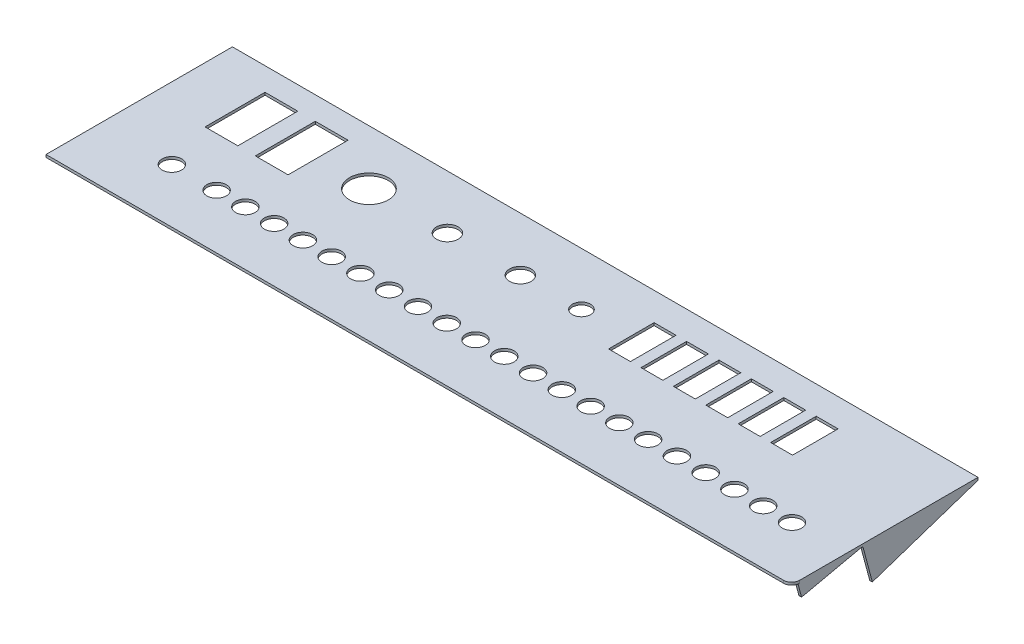
from build123d import *

# Parameters (mm, degrees)
SKETCH4_R           = 11.95
SKETCH4_R_2         = 6.65
SKETCH4_R_3         = 5.6
SKETCH4_R_4         = 6
SKETCH4_W           = 20.218579234
SKETCH4_H           = 37
SKETCH4_W_2         = 13.5
SKETCH4_H_2         = 28.1
BOSS_EXTRUDE1_DEPTH = 1.6
BOSS_EXTRUDE2_DEPTH = 1.6


with BuildPart() as part:
    # Sketch4 → Boss-Extrude1 (new body)
    with BuildSketch(Plane(origin=(0, 0, 0), x_dir=(1, 0, 0), z_dir=(0, 1, 0))):
        with BuildLine():
            Line((-60.547420146, 63.390203379), (394.452579854, 63.390203379))
            Line((394.452579854, 63.390203379), (396.952579854, 63.390203379))
            Line((396.952579854, 63.390203379), (396.952579854, -46.609796621))
            ThreePointArc((396.952579854, -46.609796621), (395.48811376, -50.145330527), (391.952579854, -51.609796621))
            Line((391.952579854, -51.609796621), (-60.547420146, -51.609796621))
            Line((-60.547420146, -51.609796621), (-63.047420146, -51.609796621))
            Line((-63.047420146, -51.609796621), (-63.047420146, 63.390203379))
            Line((-63.047420146, 63.390203379), (-60.547420146, 63.390203379))
        make_face()
        with Locations((54.9, 29.690203379)):
            Circle(SKETCH4_R, mode=Mode.SUBTRACT)
        with Locations((102.75, 30.240203379)):
            Circle(SKETCH4_R_2, mode=Mode.SUBTRACT)
        with Locations((147.75, 30.240203379)):
            Circle(SKETCH4_R_2, mode=Mode.SUBTRACT)
        with Locations((184.9, 30.790203379)):
            Circle(SKETCH4_R_3, mode=Mode.SUBTRACT)
        with Locations((-18.9, -18.109796621)):
            Circle(SKETCH4_R_4, mode=Mode.SUBTRACT)
        with Locations((8.7, -18.109796621)):
            Circle(SKETCH4_R_4, mode=Mode.SUBTRACT)
        with Locations((26.45, -18.109796621)):
            Circle(SKETCH4_R_4, mode=Mode.SUBTRACT)
        with Locations((44.2, -18.109796621)):
            Circle(SKETCH4_R_4, mode=Mode.SUBTRACT)
        with Locations((61.95, -18.109796621)):
            Circle(SKETCH4_R_4, mode=Mode.SUBTRACT)
        with Locations((79.7, -18.109796621)):
            Circle(SKETCH4_R_4, mode=Mode.SUBTRACT)
        with Locations((97.45, -18.109796621)):
            Circle(SKETCH4_R_4, mode=Mode.SUBTRACT)
        with Locations((115.2, -18.109796621)):
            Circle(SKETCH4_R_4, mode=Mode.SUBTRACT)
        with Locations((132.95, -18.109796621)):
            Circle(SKETCH4_R_4, mode=Mode.SUBTRACT)
        with Locations((150.7, -18.109796621)):
            Circle(SKETCH4_R_4, mode=Mode.SUBTRACT)
        with Locations((168.45, -18.109796621)):
            Circle(SKETCH4_R_4, mode=Mode.SUBTRACT)
        with Locations((186.2, -18.109796621)):
            Circle(SKETCH4_R_4, mode=Mode.SUBTRACT)
        with Locations((203.95, -18.109796621)):
            Circle(SKETCH4_R_4, mode=Mode.SUBTRACT)
        with Locations((221.7, -18.109796621)):
            Circle(SKETCH4_R_4, mode=Mode.SUBTRACT)
        with Locations((239.45, -18.109796621)):
            Circle(SKETCH4_R_4, mode=Mode.SUBTRACT)
        with Locations((257.2, -18.109796621)):
            Circle(SKETCH4_R_4, mode=Mode.SUBTRACT)
        with Locations((274.95, -18.109796621)):
            Circle(SKETCH4_R_4, mode=Mode.SUBTRACT)
        with Locations((292.7, -18.109796621)):
            Circle(SKETCH4_R_4, mode=Mode.SUBTRACT)
        with Locations((310.45, -18.109796621)):
            Circle(SKETCH4_R_4, mode=Mode.SUBTRACT)
        with Locations((328.2, -18.109796621)):
            Circle(SKETCH4_R_4, mode=Mode.SUBTRACT)
        with Locations((345.95, -18.109796621)):
            Circle(SKETCH4_R_4, mode=Mode.SUBTRACT)
        with Locations((363.7, -18.109796621)):
            Circle(SKETCH4_R_4, mode=Mode.SUBTRACT)
        with Locations((-18.6, 30.690203379)):
            Rectangle(SKETCH4_W, SKETCH4_H, mode=Mode.SUBTRACT)
        with Locations((12.4, 30.690203379)):
            Rectangle(SKETCH4_W, SKETCH4_H, mode=Mode.SUBTRACT)
        with Locations((241.15, 32.073143277)):
            Rectangle(SKETCH4_W_2, SKETCH4_H_2, mode=Mode.SUBTRACT)
        with Locations((221.15, 32.073143277)):
            Rectangle(SKETCH4_W_2, SKETCH4_H_2, mode=Mode.SUBTRACT)
        with Locations((261.15, 32.073143277)):
            Rectangle(SKETCH4_W_2, SKETCH4_H_2, mode=Mode.SUBTRACT)
        with Locations((281.15, 32.073143277)):
            Rectangle(SKETCH4_W_2, SKETCH4_H_2, mode=Mode.SUBTRACT)
        with Locations((301.15, 32.073143277)):
            Rectangle(SKETCH4_W_2, SKETCH4_H_2, mode=Mode.SUBTRACT)
        with Locations((321.15, 32.073143277)):
            Rectangle(SKETCH4_W_2, SKETCH4_H_2, mode=Mode.SUBTRACT)
    extrude(amount=BOSS_EXTRUDE1_DEPTH)

    # Sketch5 → Boss-Extrude2 (add)
    with BuildSketch(Plane(origin=(396.952579854, 0, 0), x_dir=(0, 0, -1), z_dir=(1, 0, 0))):
        Polygon((63.390203379, 0), (-7.609796621, 0), (-1.786368106, -21.733331092), align=None)
        Polygon((-9.109796621, 0), (-47.609796621, 0), (-45.466203081, -8), align=None)
    extrude(amount=-BOSS_EXTRUDE2_DEPTH)


solid = part.part
